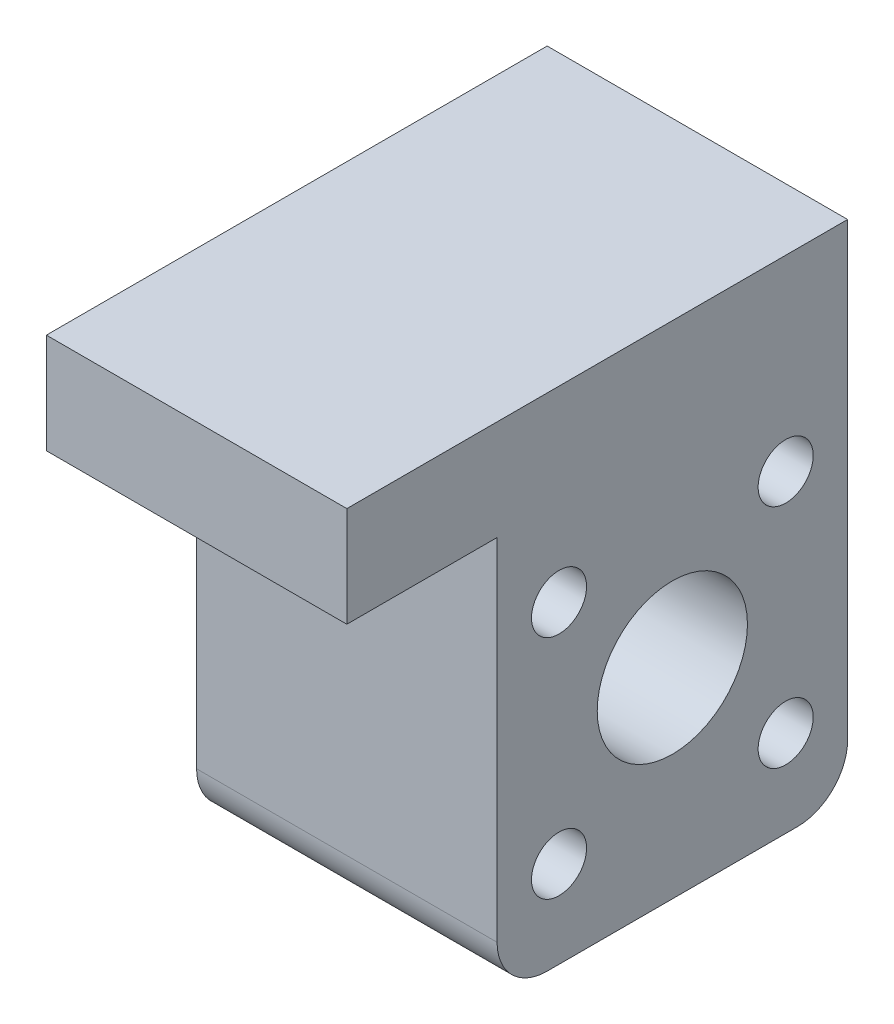
from build123d import *

# Parameters (mm, degrees)
SKETCH_2_W               = 35
SKETCH_2_H               = 50
EXTRUDE_1_DEPTH          = 30
CUT_EXTRUDE_1_DEPTH      = 43.793106922
CUT_EXTRUDE_1_DEPTH_BACK = 43.793106922
SKETCH_3_R               = 7.5
FILLET_1_R               = 5
FILLET_2_R               = 5
SKETCH_4_R               = 2.75
CUT_EXTRUDE_2_DEPTH      = 43.793106922
SKETCH_5_W               = 30
SKETCH_5_H               = 15
EXTRUDE_2_DEPTH          = 10


with BuildPart() as part:
    # 草图2 → 凸台-拉伸1 (new body)
    with BuildSketch(Plane(origin=(0, 0, 0), x_dir=(0, 0, -1), z_dir=(1, 0, 0))):
        Rectangle(SKETCH_2_W, SKETCH_2_H)
    extrude(amount=EXTRUDE_1_DEPTH)

    # 草图3 → 切除-拉伸1 (cut, two sides: drawn at the far end of the back side and taken through both)
    with BuildSketch(Plane(origin=(30, 0, 0), x_dir=(0, 0, -1), z_dir=(1, 0, 0)).offset(-CUT_EXTRUDE_1_DEPTH_BACK)):
        with Locations((0, -5)):
            Circle(SKETCH_3_R)
    extrude(amount=CUT_EXTRUDE_1_DEPTH + CUT_EXTRUDE_1_DEPTH_BACK, mode=Mode.SUBTRACT)

    # 圆角1
    fillet_1_edges = [part.edges().sort_by_distance(p)[0] for p in [
        (15, -25, -17.5),
    ]]
    fillet(fillet_1_edges, radius=FILLET_1_R)

    # 圆角2
    fillet_2_edges = [part.edges().sort_by_distance(p)[0] for p in [
        (15, -25, 17.5),
    ]]
    fillet(fillet_2_edges, radius=FILLET_2_R)

    # 草图4 → 切除-拉伸2 (cut, through all)
    with BuildSketch(Plane.ZY):
        with Locations((11.313708499, 6.313708499)):
            Circle(SKETCH_4_R)
        with Locations((-11.313708499, 6.313708499)):
            Circle(SKETCH_4_R)
        with Locations((-11.313708499, -16.313708499)):
            Circle(SKETCH_4_R)
        with Locations((11.313708499, -16.313708499)):
            Circle(SKETCH_4_R)
    extrude(amount=-CUT_EXTRUDE_2_DEPTH, mode=Mode.SUBTRACT)

    # 草图5 → 凸台-拉伸2 (add)
    with BuildSketch(Plane(origin=(0, 25, 0), x_dir=(1, 0, 0), z_dir=(0, 1, 0))):
        with Locations((15, -25)):
            Rectangle(SKETCH_5_W, SKETCH_5_H)
    extrude(amount=-EXTRUDE_2_DEPTH)


solid = part.part
